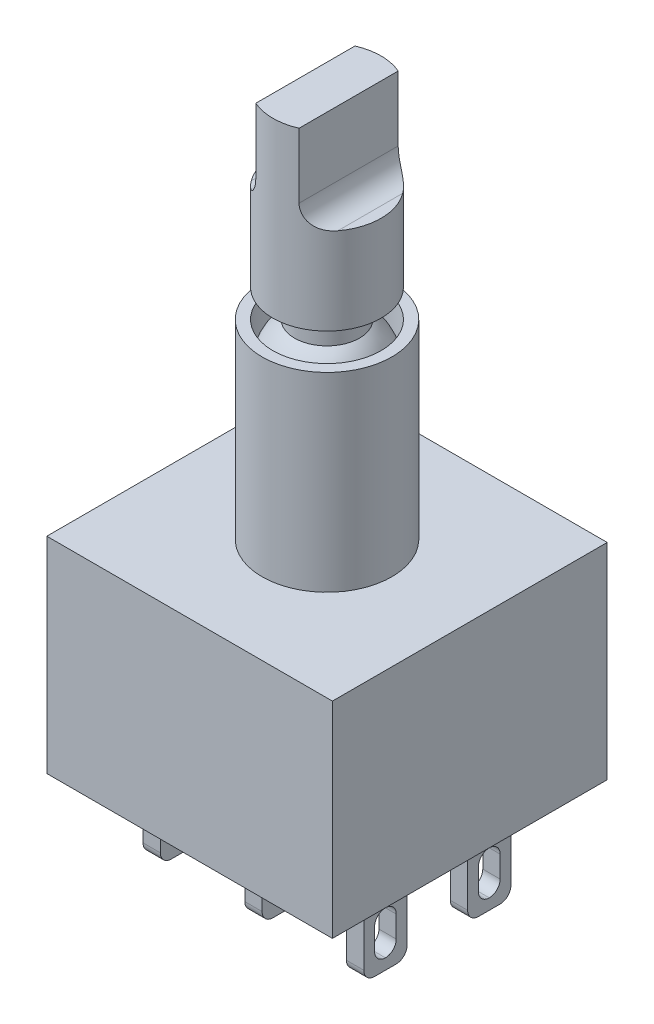
from build123d import *
from build123d.topology import SkipClean

# Parameters (mm, degrees)
SKETCH1_W           = 13.2
SKETCH1_H           = 12.7
BOSS_EXTRUDE1_DEPTH = 9.5
SKETCH2_R           = 3
BOSS_EXTRUDE2_DEPTH = 8.8
SKETCH4_R           = 2.5
CUT_EXTRUDE1_DEPTH  = 2
SKETCH5_R           = 1.5
BOSS_EXTRUDE3_DEPTH = 5
REVOLVE2_ANGLE      = 180
FILLET1_R           = 1
SKETCH6_W           = 0.8
SKETCH6_H           = 2
BOSS_EXTRUDE4_DEPTH = 4
SKETCH7_W           = 1
SKETCH7_H           = 2
CUT_EXTRUDE2_DEPTH  = 26.117773
FILLET2_R           = 0.5
BOSS_EXTRUDE5_START = 5.3
SKETCH8_R           = 2.5
BOSS_EXTRUDE5_DEPTH = 4
BOSS_EXTRUDE6_START = 4
BOSS_EXTRUDE6_DEPTH = 4
FILLET3_R           = 1


# Some blends are built 0.0001 mm under size
with BuildPart() as part:
    # Sketch1 → Boss-Extrude1 (new body)
    with BuildSketch(Plane(origin=(0, 0, 0), x_dir=(1, 0, 0), z_dir=(0, 1, 0))):
        Rectangle(SKETCH1_W, SKETCH1_H)
    extrude(amount=BOSS_EXTRUDE1_DEPTH)

    # Sketch2 → Boss-Extrude2 (add)
    with BuildSketch(Plane(origin=(0, 9.5, 0), x_dir=(1, 0, 0), z_dir=(0, 1, 0))):
        with Locations(Location((0, 0, 0), (0, 0, 270))):
            Circle(SKETCH2_R)
    extrude(amount=BOSS_EXTRUDE2_DEPTH)

    # Sketch4 → Cut-Extrude1 (cut)
    with BuildSketch(Plane(origin=(0, 18.3, 0), x_dir=(1, 0, 0), z_dir=(0, 1, 0))):
        with Locations(Location((0, 0, 0), (0, 0, 270))):
            Circle(SKETCH4_R)
    extrude(amount=-CUT_EXTRUDE1_DEPTH, mode=Mode.SUBTRACT)

    # Sketch5 → Boss-Extrude3 (add)
    with BuildSketch(Plane(origin=(0, 16.3, 0), x_dir=(1, 0, 0), z_dir=(0, 1, 0))):
        with Locations(Location((0, 0, 0), (0, 0, 270))):
            Circle(SKETCH5_R)
    extrude(amount=BOSS_EXTRUDE3_DEPTH)

    # Sketch3 → Revolve2 (revolve)
    with BuildSketch(Plane(origin=(0, 16.3, 0), x_dir=(1, 0, 0), z_dir=(0, 1, 0))):
        with BuildLine():
            Line((0, -2.5), (0, 2.5))
            ThreePointArc((0, 2.5), (-2.5, 0), (0, -2.5))
        make_face()
    revolve(axis=Axis((0, 16.3, 3), (0, 0, -1)), revolution_arc=REVOLVE2_ANGLE)

    # Fillet1
    fillet1_edges = [part.edges().sort_by_distance(p)[0] for p in [
        (0, 21.3, -1.5),
    ]]
    fillet(fillet1_edges, radius=FILLET1_R)

    # Sketch6 → Boss-Extrude4 (add)
    with BuildSketch(Plane.XZ):
        with Locations((-4.7, 2.4)):
            Rectangle(SKETCH6_W, SKETCH6_H)
        with Locations((-4.7, -2.4)):
            Rectangle(SKETCH6_W, SKETCH6_H)
        with Locations((0, -2.4)):
            Rectangle(SKETCH6_W, SKETCH6_H)
        with Locations((0, 2.4)):
            Rectangle(SKETCH6_W, SKETCH6_H)
        with Locations((4.7, 2.4)):
            Rectangle(SKETCH6_W, SKETCH6_H)
        with Locations((4.7, -2.4)):
            Rectangle(SKETCH6_W, SKETCH6_H)
    extrude(amount=BOSS_EXTRUDE4_DEPTH)

    # Sketch7 → Cut-Extrude2 (cut, through all)
    with BuildSketch(Plane.ZY.offset(5.1)):
        with Locations((-2.4, -2.5)):
            Rectangle(SKETCH7_W, SKETCH7_H)
        with Locations((2.4, -2.5)):
            Rectangle(SKETCH7_W, SKETCH7_H)
    extrude(amount=-CUT_EXTRUDE2_DEPTH, mode=Mode.SUBTRACT)

    # Fillet2
    fillet2_edges = [part.edges().sort_by_distance(p)[0] for p in [
        (4.7, -3.5, 2.9),
        (4.7, -3.5, 1.9),
        (4.7, -3.5, -1.9),
        (4.7, -3.5, -2.9),
        (4.7, -1.5, -1.9),
        (4.7, -1.5, 2.9),
        (4.7, -1.5, 1.9),
        (4.7, -1.5, -2.9),
        (0, -1.5, 1.9),
        (0, -1.5, 2.9),
        (0, -3.5, 2.9),
        (0, -3.5, 1.9),
        (0, -3.5, -1.9),
        (0, -3.5, -2.9),
        (0, -1.5, -2.9),
        (0, -1.5, -1.9),
        (-4.7, -3.5, 2.9),
        (-4.7, -1.5, 2.9),
        (-4.7, -3.5, 1.9),
        (-4.7, -1.5, 1.9),
        (-4.7, -1.5, -1.9),
        (-4.7, -1.5, -2.9),
        (-4.7, -3.5, -1.9),
        (-4.7, -3.5, -2.9),
        (0, -4, -1.4),
        (0, -4, -3.4),
        (4.7, -4, -1.4),
        (4.7, -4, -3.4),
        (4.7, -4, 1.4),
        (4.7, -4, 3.4),
        (0, -4, 3.4),
        (0, -4, 1.4),
        (-4.7, -4, 3.4),
        (-4.7, -4, 1.4),
        (-4.7, -4, -1.4),
        (-4.7, -4, -3.4),
    ]]
    fillet(fillet2_edges, radius=FILLET2_R - 0.0001)  # a hair under: the kernel refuses the full size

    # Sketch8 → Boss-Extrude5 (add)
    with BuildSketch(Plane(origin=(0, 18.3, 0), x_dir=(1, 0, 0), z_dir=(0, 1, 0)).offset(BOSS_EXTRUDE5_START)):
        with Locations(Location((0, 0, 0), (0, 0, 270))):
            Circle(SKETCH8_R)
    extrude(amount=-BOSS_EXTRUDE5_DEPTH)

    # Sketch9 → Boss-Extrude6 (add)
    with SkipClean():  # the faces are left unmerged after this step: merging them gives an invalid solid
        with BuildSketch(Plane(origin=(0, 23.6, 0), x_dir=(1, 0, 0), z_dir=(0, 1, 0)).offset(BOSS_EXTRUDE6_START)):
            with BuildLine():
                Line((-1, -2.291288), (-1, 2.291288))
                ThreePointArc((-1, 2.291288), (0, 2.5), (1, 2.291288))
                Line((1, 2.291288), (1, -2.291288))
                ThreePointArc((1, -2.291288), (0, -2.5), (-1, -2.291288))
            make_face()
        extrude(amount=-BOSS_EXTRUDE6_DEPTH)

    # Fillet3
    # the kernel refuses this fillet: 1 mm, written as the material it adds along each edge
    with BuildSketch(Plane(origin=(1, 23.6, -4.791288), x_dir=(1, 0, 0), z_dir=(0, 0, 1))) as fillet3_piece_1_section:
        with BuildLine():
            CenterArc((FILLET3_R, FILLET3_R), FILLET3_R, 180, 90)
            Line((0, FILLET3_R), (0, 0))
            Line((0, 0), (FILLET3_R, 0))
        make_face()
    fillet3_piece_1 = extrude(amount=9.582576, mode=Mode.PRIVATE)
    fillet3_piece_1 = fillet3_piece_1 & Plane(origin=(0, 23.834238, 0), x_dir=(0, 0, 1), z_dir=(0, 1, 0)) * Cylinder(2.5, 24, mode=Mode.PRIVATE)
    add(fillet3_piece_1)
    with BuildSketch(Plane(origin=(-1, 23.6, 4.791288), x_dir=(-1, 0, 0), z_dir=(0, 0, -1))) as fillet3_piece_2_section:
        with BuildLine():
            CenterArc((FILLET3_R, FILLET3_R), FILLET3_R, 180, 90)
            Line((0, FILLET3_R), (0, 0))
            Line((0, 0), (FILLET3_R, 0))
        make_face()
    fillet3_piece_2 = extrude(amount=9.582576, mode=Mode.PRIVATE)
    fillet3_piece_2 = fillet3_piece_2 & Plane(origin=(0, 23.834238, 0), x_dir=(0, 0, 1), z_dir=(0, 1, 0)) * Cylinder(2.5, 24, mode=Mode.PRIVATE)
    add(fillet3_piece_2)


solid = part.part
